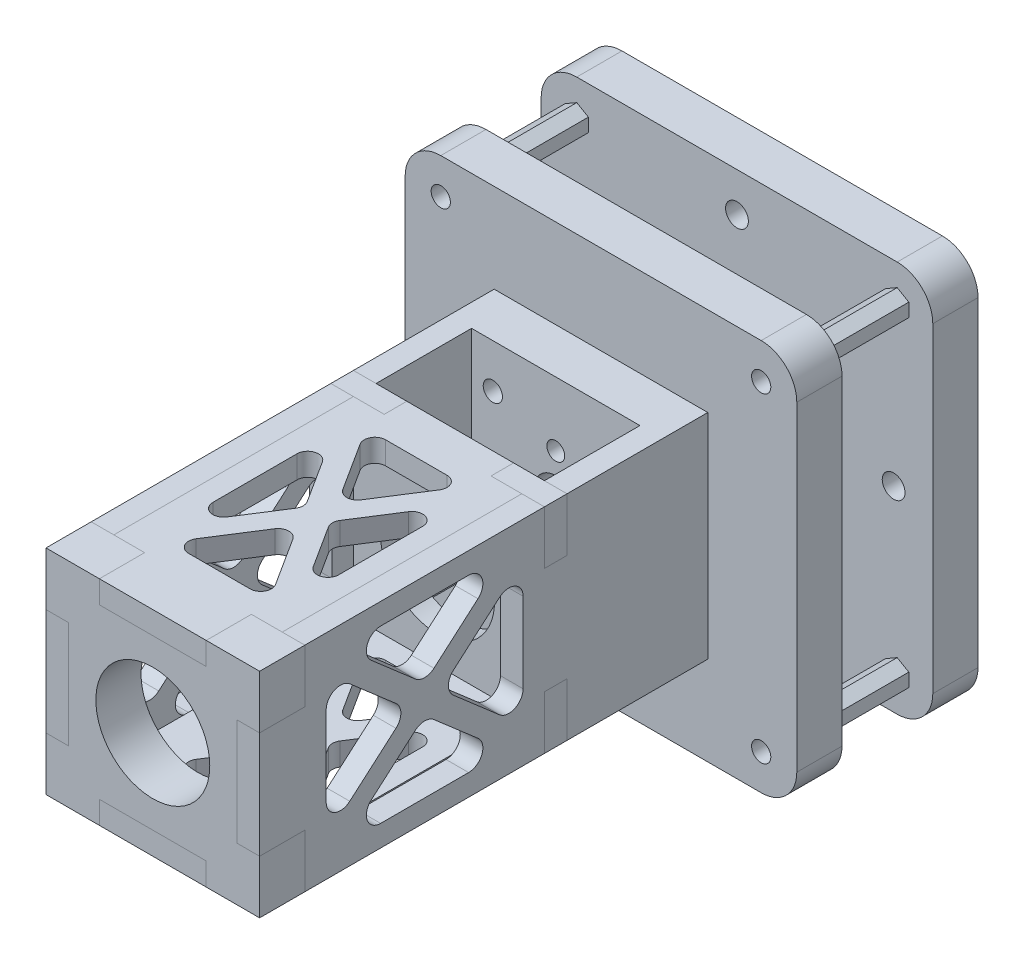
from build123d import *

# Parameters (mm, degrees)
SKETCH_1_W               = 30
SKETCH_1_H               = 30
EXTRUDE_1_DEPTH          = 6.35
SKETCH_2_W               = 3.175
SKETCH_2_H               = 15
SKETCH_2_W_2             = 15
SKETCH_2_H_2             = 3.175
CUT_EXTRUDE_1_DEPTH      = 23.143226955
SKETCH_4_W               = 3.175
SKETCH_4_H               = 30
EXTRUDE_2_DEPTH          = 3.175
SKETCH_4_W_2             = 6.35
SKETCH_4_H_2             = 15
EXTRUDE_2_2_DEPTH        = 3.175
EXTRUDE_3_DEPTH          = 3.175
SKETCH_7_W               = 3.175
SKETCH_7_H               = 15
CUT_EXTRUDE_3_DEPTH      = 32.246422242
EXTRUDE_4_DEPTH          = 6.35
CUT_EXTRUDE_4_DEPTH      = 46.276925691
CUT_EXTRUDE_4_DEPTH_BACK = 46.276925691
SKETCH_8_R               = 8
SKETCH_10_W              = 15
SKETCH_10_H              = 3.175
CUT_EXTRUDE_5_DEPTH      = 46.276925691
SKETCH_11_W              = 15
SKETCH_11_H              = 6.35
EXTRUDE_5_DEPTH          = 3.175
EXTRUDE_START            = -3.175
EXTRUDE_6_OUTLINE_W      = 33.65
EXTRUDE_6_OUTLINE_H      = 30
EXTRUDE_6_DEPTH          = 3.175
FILLET_1_R               = 2
SKETCH_17_W              = 3.175
SKETCH_17_H              = 15
EXTRUDE_10_DEPTH         = 3.175
SKETCH_13_W              = 6.35
SKETCH_13_H              = 15
EXTRUDE_7_DEPTH          = 3.175
SKETCH_15_W              = 6.35
SKETCH_15_H              = 15
EXTRUDE_8_DEPTH          = 3.175
EXTRUDE_9_DEPTH          = 3.175
FILLET_2_R               = 1.5
SKETCH_3_R               = 1.25
SKETCH_3_R_2             = 3
CUT_EXTRUDE_7_DEPTH      = 67.420667515
CUT_EXTRUDE_8_DEPTH      = 67.420667515
CUT_EXTRUDE_8_DEPTH_BACK = 67.420667515
SKETCH_19_R              = 1.35
EXTRUDE_START_2          = 6.35
SKETCH_34_R              = 1.35
SKETCH_34_R_2            = 8.5
EXTRUDE_17_DEPTH         = 6.35
SKETCH_35_R              = 1.35
EXTRUDE_18_DEPTH         = 12.75
EXTRUDE_18_2_DEPTH       = 12.75
EXTRUDE_18_3_DEPTH       = 12.75
EXTRUDE_18_4_DEPTH       = 12.75
SKETCH_36_R              = 1.35
EXTRUDE_19_DEPTH         = 6.35
SKETCH_37_R              = 5
SKETCH_37_R_2            = 1.6
CUT_EXTRUDE_11_DEPTH     = 97.56945324


# Read off the part's stored shape, not the designer's step: 凸台-拉伸6
with BuildPart() as part:
    # 草图1 → 凸台-拉伸1 (new body)
    with BuildSketch(Plane.XY):
        Rectangle(SKETCH_1_W, SKETCH_1_H)
    extrude(amount=EXTRUDE_1_DEPTH)

    # 草图2 → 切除-拉伸1 (cut, through all)
    with BuildSketch(Plane.XY.offset(6.35)):
        with Locations((-13.4125, 0)):
            Rectangle(SKETCH_2_W, SKETCH_2_H)
        with Locations((0, -13.4125)):
            Rectangle(SKETCH_2_W_2, SKETCH_2_H_2)
        with Locations((13.4125, 0)):
            Rectangle(SKETCH_2_W, SKETCH_2_H)
    extrude(amount=-CUT_EXTRUDE_1_DEPTH, mode=Mode.SUBTRACT)

    # 草图11 → 凸台-拉伸5 (add)
    with BuildSketch(Plane.XZ.offset(11.825)):
        with Locations((0, 3.175)):
            Rectangle(SKETCH_11_W, SKETCH_11_H)
    extrude(amount=EXTRUDE_5_DEPTH)

    # 草图3 → 切除-拉伸7 (cut, through all)
    with BuildSketch(Plane(origin=(0, 0, 0), x_dir=(-1, 0, 0), z_dir=(0, 0, -1))):
        with Locations((-6, 0)):
            Circle(SKETCH_3_R)
        Circle(SKETCH_3_R_2)
        with Locations((6, 0)):
            Circle(SKETCH_3_R)
        with Locations((0, -6)):
            Circle(SKETCH_3_R)
        with Locations((0, 6)):
            Circle(SKETCH_3_R)
    extrude(amount=-CUT_EXTRUDE_7_DEPTH, mode=Mode.SUBTRACT)

    # 草图19 → 切除-拉伸8 (cut, two sides: drawn at the far end of the back side and taken through both)
    with BuildSketch(Plane(origin=(0, 0, 0), x_dir=(-1, 0, 0), z_dir=(0, 0, -1)).offset(-CUT_EXTRUDE_8_DEPTH_BACK)):
        with Locations((-8.838834765, 8.838834765)):
            Circle(SKETCH_19_R)
        with Locations((8.838834765, 8.838834765)):
            Circle(SKETCH_19_R)
        with Locations((-8.838834765, -8.838834765)):
            Circle(SKETCH_19_R)
        with Locations((8.838834765, -8.838834765)):
            Circle(SKETCH_19_R)
    extrude(amount=CUT_EXTRUDE_8_DEPTH + CUT_EXTRUDE_8_DEPTH_BACK, mode=Mode.SUBTRACT)



with BuildPart() as body_2:
    # 草图4 → 凸台-拉伸2 (new body)
    with BuildSketch(Plane.ZY.offset(11.825)):
        with Locations((21.354577128, 0)):
            Rectangle(SKETCH_4_W, SKETCH_4_H)
    extrude(amount=EXTRUDE_2_DEPTH)

    # 草图6 → 凸台-拉伸3 (add)
    with BuildSketch(Plane(origin=(0, 0, 19.767077128), x_dir=(-1, 0, 0), z_dir=(0, 0, -1))):
        Polygon((7.5, -15), (11.825, -15), (11.825, -7.5), (11.825, 7.5), (11.825, 15), (-15, 15), (-15, 7.5), (-11.825, 7.5), (-11.825, -7.5), (-15, -7.5), (-15, -15), (-7.5, -15), (-7.5, -11.825), (7.5, -11.825), align=None)
    extrude(amount=-EXTRUDE_3_DEPTH)

    # 草图7 → 切除-拉伸3 (cut, through all)
    with BuildSketch(Plane.XY.offset(22.942077128)):
        with Locations((-13.4125, 0)):
            Rectangle(SKETCH_7_W, SKETCH_7_H)
    extrude(amount=-CUT_EXTRUDE_3_DEPTH, mode=Mode.SUBTRACT)


with BuildPart() as body_3:
    # 草图4 → Extrude 2 2 (new body)
    with BuildSketch(Plane.ZY.offset(11.825)):
        with Locations((3.175, 0)):
            Rectangle(SKETCH_4_W_2, SKETCH_4_H_2)
    extrude(amount=EXTRUDE_2_2_DEPTH)


with BuildPart() as body_4:
    # 草图9 → 凸台-拉伸4 (new body)
    with BuildSketch(Plane.XY.offset(62.942077128)):
        Polygon((7.5, 15), (7.5, 11.825), (-7.5, 11.825), (-7.5, 15), (-15, 15), (-15, 7.5), (-11.825, 7.5), (-11.825, -7.5), (-15, -7.5), (-15, -15), (-7.5, -15), (-7.5, -11.825), (7.5, -11.825), (7.5, -15), (15, -15), (15, -7.5), (11.825, -7.5), (11.825, 7.5), (15, 7.5), (15, 15), align=None)
    extrude(amount=-EXTRUDE_4_DEPTH)


with BuildPart() as cut_extrude_4_tool:
    # 草图8 → 切除-拉伸4 (new, two sides: drawn at the far end of the back side and taken through both)
    with BuildSketch(Plane.XY.offset(22.942077128).offset(-CUT_EXTRUDE_4_DEPTH_BACK)):
        Circle(SKETCH_8_R)
    extrude(amount=CUT_EXTRUDE_4_DEPTH + CUT_EXTRUDE_4_DEPTH_BACK)


with BuildPart() as body_4_1:
    add(body_4.part)

    # 切除-拉伸4: cut by cut_extrude_4_tool
    add(cut_extrude_4_tool.part, mode=Mode.SUBTRACT)


with BuildPart() as body_2_1:
    add(body_2.part)

    # 切除-拉伸4: cut by cut_extrude_4_tool
    add(cut_extrude_4_tool.part, mode=Mode.SUBTRACT)

    # 草图10 → 切除-拉伸5 (cut, through all)
    with BuildSketch(Plane.XY.offset(22.942077128)):
        with Locations((0, 13.4125)):
            Rectangle(SKETCH_10_W, SKETCH_10_H)
    extrude(amount=-CUT_EXTRUDE_5_DEPTH, mode=Mode.SUBTRACT)


with BuildPart() as body_5:
    # 凸台-拉伸6 outline → 凸台-拉伸6 (new body)
    # profile 1 of 2: a face of its own
    with BuildSketch(Plane.ZY.offset(15).offset(EXTRUDE_START)):
        with Locations((39.767077128, 0)):
            Rectangle(EXTRUDE_6_OUTLINE_W, EXTRUDE_6_OUTLINE_H)
        Polygon((51.303755469, -12), (28.230398787, -12), (39.767077128, -1.986246648), align=None, mode=Mode.SUBTRACT)
        Polygon((37.478755469, 0), (25.942077128, -10.013753352), (25.942077128, 10.013753352), align=None, mode=Mode.SUBTRACT)
        Polygon((39.767077128, 1.986246648), (28.230398787, 12), (51.303755469, 12), align=None, mode=Mode.SUBTRACT)
        Polygon((53.592077128, -10.013753352), (42.055398787, 0), (53.592077128, 10.013753352), align=None, mode=Mode.SUBTRACT)
    # profile 2 of 2: a face of its own
    with BuildSketch(Plane.ZY.offset(15).offset(EXTRUDE_START)):
        Polygon((6.35, -15), (19.767077128, -15), (19.767077128, -7.5), (19.942077128, -7.5), (19.942077128, 7.5), (19.767077128, 7.5), (19.767077128, 15), (6.35, 15), (6.35, 7.5), (0, 7.5), (0, -7.5), (6.35, -7.5), align=None)
    extrude(amount=EXTRUDE_6_DEPTH)

    # 圆角1
    fillet_1_edges = [body_5.edges().sort_by_distance(p)[0] for p in [
        (-13.4125, -1.986246648, 39.767077128),
        (-13.4125, -12, 28.230398787),
        (-13.4125, 0, 42.055398787),
        (-13.4125, -10.013753352, 53.592077128),
        (-13.4125, 1.986246648, 39.767077128),
        (-13.4125, 12, 51.303755469),
        (-13.4125, 0, 37.478755469),
        (-13.4125, 10.013753352, 25.942077128),
        (-13.4125, -12, 51.303755469),
        (-13.4125, 10.013753352, 53.592077128),
        (-13.4125, 12, 28.230398787),
        (-13.4125, -10.013753352, 25.942077128),
    ]]
    fillet(fillet_1_edges, radius=FILLET_1_R)

    # 草图17 → 凸台-拉伸10 (add)
    with BuildSketch(Plane.ZY.offset(15)):
        with Locations((21.354577128, 0)):
            Rectangle(SKETCH_17_W, SKETCH_17_H)
    extrude(amount=-EXTRUDE_10_DEPTH)

    # Combine 1: union body 3
    add(body_3.part)


with BuildPart() as body_5_2:
    # 镜向1: mirrored copy
    add(body_5.part.mirror(Plane(origin=(0, 0, 0), x_dir=(0, 0, 1), z_dir=(1, 0, 0))))

    # 草图13 → 凸台-拉伸7 (add)
    with BuildSketch(Plane(origin=(11.825, 0, 0), x_dir=(0, 0, -1), z_dir=(1, 0, 0))):
        with Locations((-59.767077128, 0)):
            Rectangle(SKETCH_13_W, SKETCH_13_H)
    extrude(amount=EXTRUDE_7_DEPTH)


with BuildPart() as body_5_1:
    add(body_5.part)

    # 草图15 → 凸台-拉伸8 (add)
    with BuildSketch(Plane.ZY.offset(11.825)):
        with Locations((59.767077128, 0)):
            Rectangle(SKETCH_15_W, SKETCH_15_H)
    extrude(amount=EXTRUDE_8_DEPTH)


with BuildPart() as body_6:
    # 草图16 → 凸台-拉伸9 (new body)
    with BuildSketch(Plane.XZ.offset(11.825)):
        Polygon((11.825, 56.592077128), (7.5, 56.592077128), (7.5, 62.942077128), (-7.5, 62.942077128), (-7.5, 56.592077128), (-11.825, 56.592077128), (-11.825, 22.942077128), (-7.5, 22.942077128), (-7.5, 19.767077128), (7.5, 19.767077128), (7.5, 22.942077128), (11.825, 22.942077128), align=None)
        Polygon((-1.779554694, 39.767077128), (-8.825, 28.729878107), (-8.825, 50.804276149), align=None, mode=Mode.SUBTRACT)
        Polygon((-7.045445306, 25.942077128), (0, 36.979276149), (7.045445306, 25.942077128), align=None, mode=Mode.SUBTRACT)
        Polygon((8.825, 28.729878107), (1.779554694, 39.767077128), (8.825, 50.804276149), align=None, mode=Mode.SUBTRACT)
        Polygon((7.045445306, 53.592077128), (0, 42.554878107), (-7.045445306, 53.592077128), align=None, mode=Mode.SUBTRACT)
    extrude(amount=EXTRUDE_9_DEPTH)

    # 圆角2
    fillet_2_edges = [body_6.edges().sort_by_distance(p)[0] for p in [
        (7.045445306, -13.4125, 53.592077128),
        (-7.045445306, -13.4125, 53.592077128),
        (7.045445306, -13.4125, 25.942077128),
        (0, -13.4125, 36.979276149),
        (-8.825, -13.4125, 50.804276149),
        (-8.825, -13.4125, 28.729878107),
        (8.825, -13.4125, 28.729878107),
        (8.825, -13.4125, 50.804276149),
        (-7.045445306, -13.4125, 25.942077128),
        (-1.779554694, -13.4125, 39.767077128),
        (1.779554694, -13.4125, 39.767077128),
        (0, -13.4125, 42.554878107),
    ]]
    fillet(fillet_2_edges, radius=FILLET_2_R)


with BuildPart() as body_7:
    # 镜向3: mirrored copy
    add(body_6.part.mirror(Plane.ZX))


with BuildPart() as part_1:
    add(part.part)

    add(body_5_1.part)  # 凸台-拉伸17 merges body 5

    add(body_5_2.part)  # 凸台-拉伸17 merges body 5 2
    # 草图34 → 凸台-拉伸17 (add)
    with BuildSketch(Plane(origin=(0, 0, 0), x_dir=(-1, 0, 0), z_dir=(0, 0, -1)).offset(EXTRUDE_START_2)):
        with BuildLine():
            Line((-22.5, -27.5), (22.5, -27.5))
            ThreePointArc((22.5, -27.5), (26.035533906, -26.035533906), (27.5, -22.5))
            Line((27.5, -22.5), (27.5, 22.5))
            ThreePointArc((27.5, 22.5), (26.035533906, 26.035533906), (22.5, 27.5))
            Line((22.5, 27.5), (-22.5, 27.5))
            ThreePointArc((-22.5, 27.5), (-26.035533906, 26.035533906), (-27.5, 22.5))
            Line((-27.5, 22.5), (-27.5, -22.5))
            ThreePointArc((-27.5, -22.5), (-26.035533906, -26.035533906), (-22.5, -27.5))
        make_face()
        with Locations((-8.838834765, 8.838834765)):
            Circle(SKETCH_34_R, mode=Mode.SUBTRACT)
        with Locations((-8.838834765, -8.838834765)):
            Circle(SKETCH_34_R, mode=Mode.SUBTRACT)
        with Locations((8.838834765, -8.838834765)):
            Circle(SKETCH_34_R, mode=Mode.SUBTRACT)
        with Locations((8.838834765, 8.838834765)):
            Circle(SKETCH_34_R, mode=Mode.SUBTRACT)
        with Locations((-22.5, 22.5)):
            Circle(SKETCH_34_R, mode=Mode.SUBTRACT)
        with Locations((22.5, 22.5)):
            Circle(SKETCH_34_R, mode=Mode.SUBTRACT)
        with Locations((-22.5, -22.5)):
            Circle(SKETCH_34_R, mode=Mode.SUBTRACT)
        with Locations((22.5, -22.5)):
            Circle(SKETCH_34_R, mode=Mode.SUBTRACT)
        Circle(SKETCH_34_R_2, mode=Mode.SUBTRACT)
    extrude(amount=-EXTRUDE_17_DEPTH)


with BuildPart() as body_6_2:
    # 草图35 → 凸台-拉伸18 (new body)
    with BuildSketch(Plane(origin=(0, 0, -6.35), x_dir=(-1, 0, 0), z_dir=(0, 0, -1))):
        Polygon((20.864126446, 23.444472037), (22.5, 24.388944074), (24.135873554, 23.444472037), (24.135873554, 21.555527963), (22.5, 20.611055926), (20.864126446, 21.555527963), align=None)
        with Locations(Location((22.5, 22.5, 0), (0, 0, 180))):
            Circle(SKETCH_35_R, mode=Mode.SUBTRACT)
    extrude(amount=EXTRUDE_18_DEPTH)


with BuildPart() as body_7_2:
    # 草图35 → Extrude 18 2 (new body)
    with BuildSketch(Plane(origin=(0, 0, -6.35), x_dir=(-1, 0, 0), z_dir=(0, 0, -1))):
        Polygon((-22.5, 24.388944074), (-24.135873554, 23.444472037), (-24.135873554, 21.555527963), (-22.5, 20.611055926), (-20.864126446, 21.555527963), (-20.864126446, 23.444472037), align=None)
        with Locations((-22.5, 22.5)):
            Circle(SKETCH_35_R, mode=Mode.SUBTRACT)
    extrude(amount=EXTRUDE_18_2_DEPTH)


with BuildPart() as body_8:
    # 草图35 → Extrude 18 3 (new body)
    with BuildSketch(Plane(origin=(0, 0, -6.35), x_dir=(-1, 0, 0), z_dir=(0, 0, -1))):
        Polygon((22.5, -24.388944074), (24.135873554, -23.444472037), (24.135873554, -21.555527963), (22.5, -20.611055926), (20.864126446, -21.555527963), (20.864126446, -23.444472037), align=None)
        with Locations((22.5, -22.5)):
            Circle(SKETCH_35_R, mode=Mode.SUBTRACT)
    extrude(amount=EXTRUDE_18_3_DEPTH)


with BuildPart() as body_9:
    # 草图35 → Extrude 18 4 (new body)
    with BuildSketch(Plane(origin=(0, 0, -6.35), x_dir=(-1, 0, 0), z_dir=(0, 0, -1))):
        Polygon((-20.864126446, -23.444472037), (-22.5, -24.388944074), (-24.135873554, -23.444472037), (-24.135873554, -21.555527963), (-22.5, -20.611055926), (-20.864126446, -21.555527963), align=None)
        with Locations(Location((-22.5, -22.5, 0), (0, 0, 180))):
            Circle(SKETCH_35_R, mode=Mode.SUBTRACT)
    extrude(amount=EXTRUDE_18_4_DEPTH)


with BuildPart() as body_10:
    # 草图36 → 凸台-拉伸19 (new body)
    with BuildSketch(Plane(origin=(0, 0, -19.1), x_dir=(-1, 0, 0), z_dir=(0, 0, -1))):
        with BuildLine():
            Line((-22.5, -27.5), (22.5, -27.5))
            ThreePointArc((22.5, -27.5), (26.035533906, -26.035533906), (27.5, -22.5))
            Line((27.5, -22.5), (27.5, 22.5))
            ThreePointArc((27.5, 22.5), (26.035533906, 26.035533906), (22.5, 27.5))
            Line((22.5, 27.5), (-22.5, 27.5))
            ThreePointArc((-22.5, 27.5), (-26.035533906, 26.035533906), (-27.5, 22.5))
            Line((-27.5, 22.5), (-27.5, -22.5))
            ThreePointArc((-27.5, -22.5), (-26.035533906, -26.035533906), (-22.5, -27.5))
        make_face()
        with Locations((22.5, -22.5)):
            Circle(SKETCH_36_R, mode=Mode.SUBTRACT)
        with Locations((-22.5, -22.5)):
            Circle(SKETCH_36_R, mode=Mode.SUBTRACT)
        with Locations((22.5, 22.5)):
            Circle(SKETCH_36_R, mode=Mode.SUBTRACT)
        with Locations((-22.5, 22.5)):
            Circle(SKETCH_36_R, mode=Mode.SUBTRACT)
    extrude(amount=EXTRUDE_19_DEPTH)

    # 草图37 → 切除-拉伸11 (cut, through all)
    with BuildSketch(Plane(origin=(0, 0, -25.45), x_dir=(-1, 0, 0), z_dir=(0, 0, -1))):
        Circle(SKETCH_37_R)
        with Locations((0, 12.5)):
            Circle(SKETCH_37_R_2)
        with Locations((-9.5, 0)):
            Circle(SKETCH_37_R_2)
        with Locations((0, -12.5)):
            Circle(SKETCH_37_R_2)
        with Locations((9.5, 0)):
            Circle(SKETCH_37_R_2)
        with Locations((0, 22)):
            Circle(SKETCH_37_R_2)
        with Locations((22, 0)):
            Circle(SKETCH_37_R_2)
        with Locations((0, -22)):
            Circle(SKETCH_37_R_2)
        with Locations((-22, 0)):
            Circle(SKETCH_37_R_2)
    extrude(amount=-CUT_EXTRUDE_11_DEPTH, mode=Mode.SUBTRACT)


solid = Compound([body_4_1.part, body_2_1.part, body_6.part, body_7.part, part_1.part, body_6_2.part, body_7_2.part, body_8.part, body_9.part, body_10.part])
